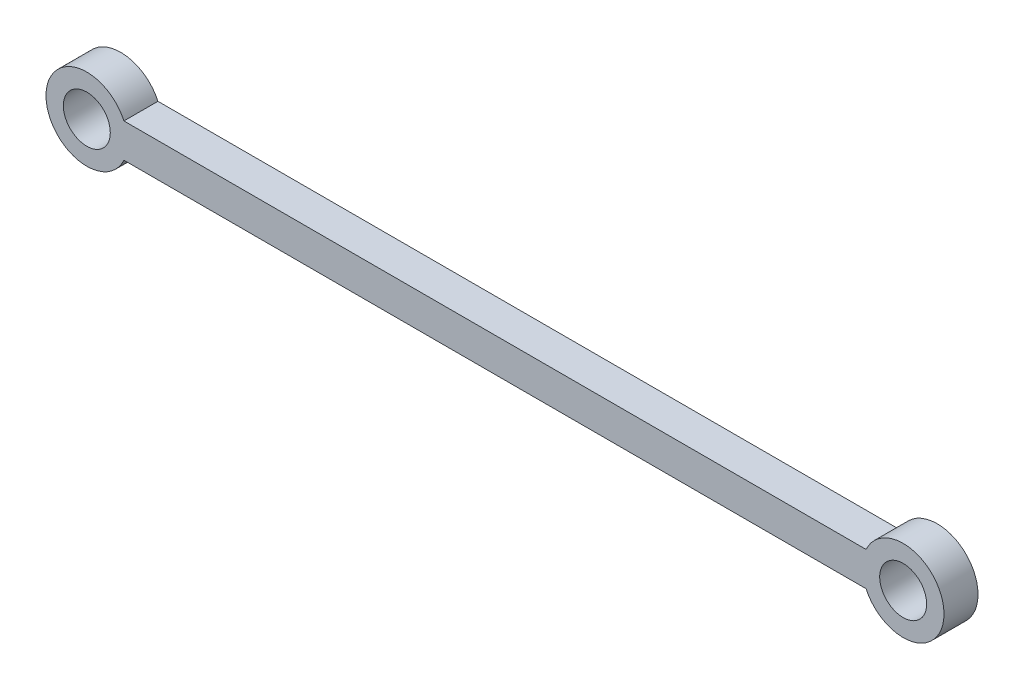
from build123d import *

# Parameters (mm, degrees)
SKETCH1_R          = 3.45
BASE_FLANGE1_DEPTH = 5


# Sheet-metal steps are written as plain solids
with BuildPart() as part:
    # Sketch1 → Base-Flange1 (new body)
    with BuildSketch(Plane.XY):
        with BuildLine():
            Line((-114.545643943, 2.5), (-5.454356057, 2.5))
            ThreePointArc((-5.454356057, 2.5), (6, 0), (-5.454356057, -2.5))
            Line((-5.454356057, -2.5), (-114.545643943, -2.5))
            ThreePointArc((-114.545643943, -2.5), (-126, 0), (-114.545643943, 2.5))
        make_face()
        Circle(SKETCH1_R, mode=Mode.SUBTRACT)
        with Locations((-120, 0)):
            Circle(SKETCH1_R, mode=Mode.SUBTRACT)
    extrude(amount=-BASE_FLANGE1_DEPTH)


solid = part.part
